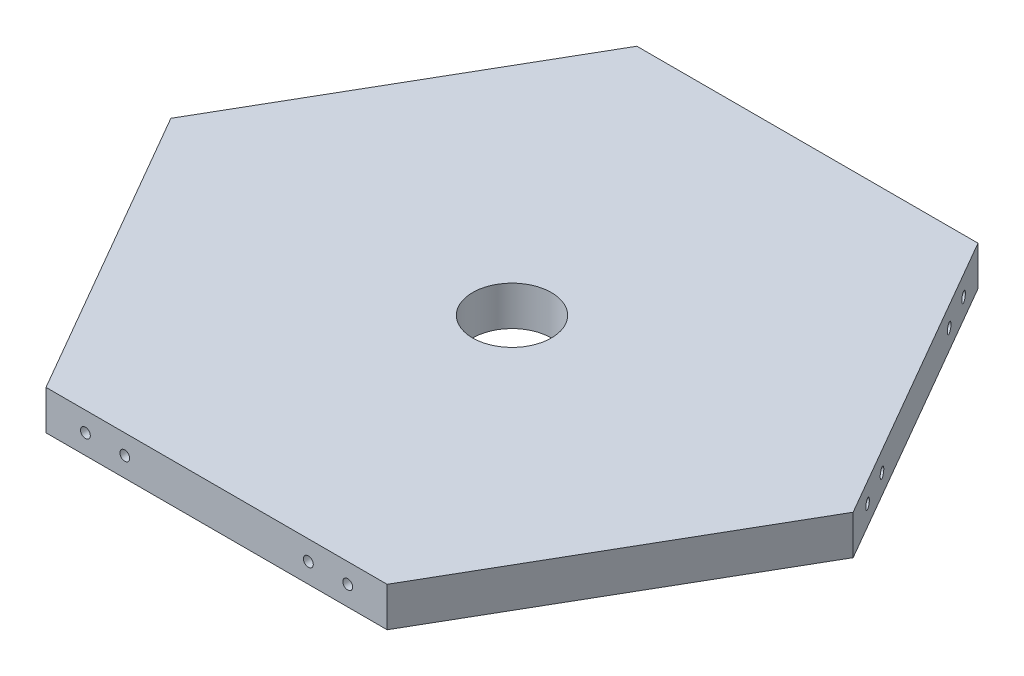
from build123d import *

# Parameters (mm, degrees)
BOSS_EXTRUDE1_DEPTH = 10
SKETCH2_R           = 1.25
CUT_EXTRUDE1_DEPTH  = 10
SKETCH3_R           = 10
CUT_EXTRUDE2_DEPTH  = 116
CIRPATTERN1_COUNT   = 3


with BuildPart() as part:
    # Sketch1 → Boss-Extrude1 (new body)
    with BuildSketch(Plane(origin=(0, 0, 0), x_dir=(1, 0, 0), z_dir=(0, 1, 0))):
        Polygon((-43.301270189, -75), (43.301270189, -75), (86.602540378, 0), (43.301270189, 75), (-43.301270189, 75), (-86.602540378, 0), align=None)
    extrude(amount=BOSS_EXTRUDE1_DEPTH)

    # Sketch2 → Cut-Extrude1 (cut)
    with BuildSketch(Plane.XY.offset(75)):
        with Locations((-33.301270189, 5)):
            Circle(SKETCH2_R)
        with Locations((-23.301270189, 5)):
            Circle(SKETCH2_R)
        with Locations((23.301270189, 5)):
            Circle(SKETCH2_R)
        with Locations((33.301270189, 5)):
            Circle(SKETCH2_R)
    cut_extrude1 = extrude(amount=-CUT_EXTRUDE1_DEPTH, mode=Mode.SUBTRACT)

    # Sketch3 → Cut-Extrude2 (cut, through all)
    with BuildSketch(Plane(origin=(0, 10, 0), x_dir=(1, 0, 0), z_dir=(0, 1, 0))):
        Circle(SKETCH3_R)
    extrude(amount=-CUT_EXTRUDE2_DEPTH, mode=Mode.SUBTRACT)

    # CirPattern1: Cut-Extrude1 ×3 about axis
    cirpattern1_axis = Axis((0, 0, 0), (0, 1, 0))
    for i in range(1, CIRPATTERN1_COUNT):
        add(cut_extrude1.rotate(cirpattern1_axis, i * 360 / CIRPATTERN1_COUNT), mode=Mode.SUBTRACT)


solid = part.part
